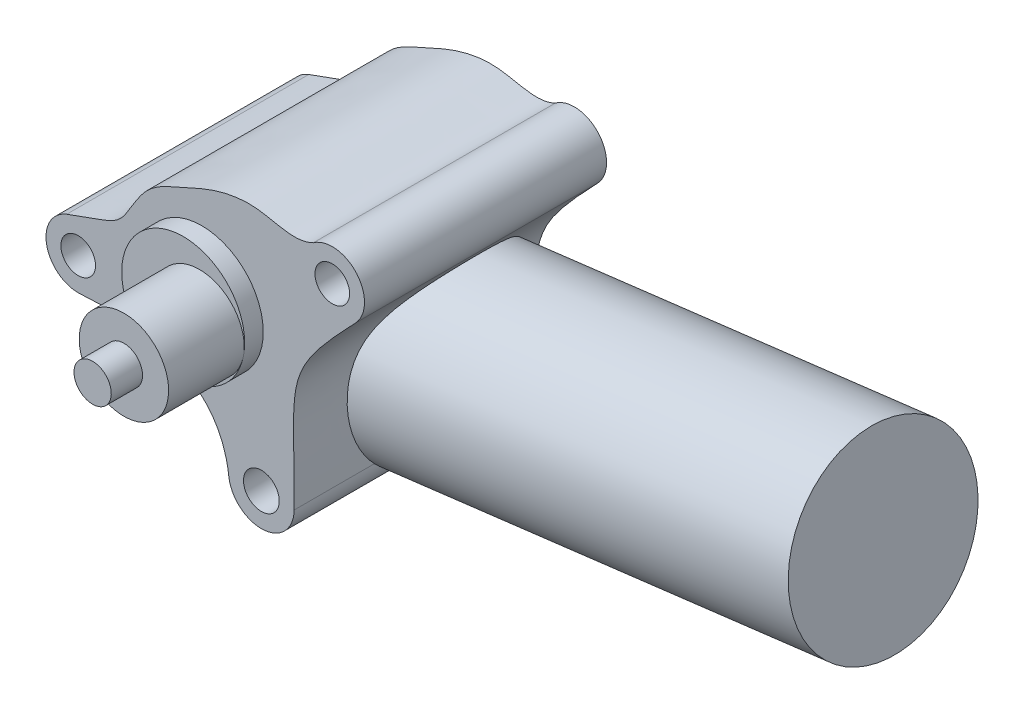
from build123d import *

# Parameters (mm, degrees)
SKETCH2_R           = 16.500244438
BOSS_EXTRUDE1_DEPTH = 5
SKETCH3_R           = 4.65
SKETCH3_R_2         = 4.8
BOSS_EXTRUDE2_DEPTH = 65
BOSS_EXTRUDE4_REACH = 218.511
SKETCH7_R           = 25.3


with BuildPart() as part:
    # Sketch1 → Revolve1 (revolve)
    with BuildSketch(Plane(origin=(0, 0, 0), x_dir=(0, 0, -1), z_dir=(1, 0, 0))):
        Polygon((0, 0), (0, 5), (8.4, 5), (8.4, 12), (28.7, 12), (28.7, 0), align=None)
    revolve(axis=Axis((0, 0, -28.7), (0, 0, 1)))

    # Sketch2 → Boss-Extrude1 (add)
    with BuildSketch(Plane(origin=(0, 0, -28.7), x_dir=(-1, 0, 0), z_dir=(0, 0, -1))):
        with Locations((4.39, 0.99)):
            Circle(SKETCH2_R)
    extrude(amount=BOSS_EXTRUDE1_DEPTH)


with BuildPart() as body_2:
    # Sketch3 → Boss-Extrude2 (new body)
    with BuildSketch(Plane(origin=(0, 0, -33.7), x_dir=(-1, 0, 0), z_dir=(0, 0, -1))):
        with BuildLine():
            ThreePointArc((-25.548245524, 28.485313255), (-37.161465582, 27.194147519), (-36.892746776, 15.512461884))
            add(Edge.make_bspline(
                [(-36.892746776, 15.512461884), (-16.660003911, -5.582667341), (-20.638424671, -4.78611149), (-20.409767393, -36.233983054)],
                knots=[0, 0, 0, 0, 1, 1, 1, 1], degree=3))
            ThreePointArc((-20.409767393, -36.233983054), (-12.098606112, -44.956424988), (-2.871583495, -37.209267526))
            add(Edge.make_bspline(
                [(36.955430558, -14.692174435), (22.195397981, -13.623643749), (-0.238034163, -15.06573818), (-2.871583495, -37.209267526)],
                knots=[0, 0, 0, 0, 1, 1, 1, 1], degree=3))
            ThreePointArc((36.955430558, -14.692174435), (46.024415193, -7.939412796), (40.664758681, 2.016507761))
            add(Edge.make_bspline(
                [(40.664758681, 2.016507761), (29.808956582, 6.160357802), (26.32247658, 5.890198419), (19.64216297, 19.806043739), (11.059797635, 22.991473655), (1.668902974, 27.530132897), (-10.611608742, 30.664265995), (-20.537859469, 25.961417581), (-25.548245524, 28.485313255)],
                knots=[0, 0, 0, 0, 0.2353579, 0.373961373, 0.518248087, 0.593954256, 0.794427619, 1, 1, 1, 1], degree=3))
        make_face()
        with Locations((-30.65, 21.5)):
            Circle(SKETCH3_R, mode=Mode.SUBTRACT)
        with Locations((37.58, -6.064752282)):
            Circle(SKETCH3_R, mode=Mode.SUBTRACT)
        with Locations((-11.61, -36.17)):
            Circle(SKETCH3_R_2, mode=Mode.SUBTRACT)
    extrude(amount=BOSS_EXTRUDE2_DEPTH)

    # Sketch7 → Boss-Extrude4 (add, up to next)
    with BuildSketch(Plane(origin=(136.327278725, 16.738885057, 0), x_dir=(0.12186934340515132, -0.9925461516413215, 0), z_dir=(0.9925461516413217, 0.12186934340515133, 0)), mode=Mode.PRIVATE) as boss_extrude4_sk1:
        with Locations((20.815297382, 73.4)):
            Circle(SKETCH7_R)
    boss_extrude4_tool1 = extrude(boss_extrude4_sk1.sketch, amount=-BOSS_EXTRUDE4_REACH, mode=Mode.PRIVATE) - body_2.part
    add(boss_extrude4_tool1.solids().sort_by_distance((138.864025, -3.921258, -73.4))[0])


solid = Compound([part.part, body_2.part])
